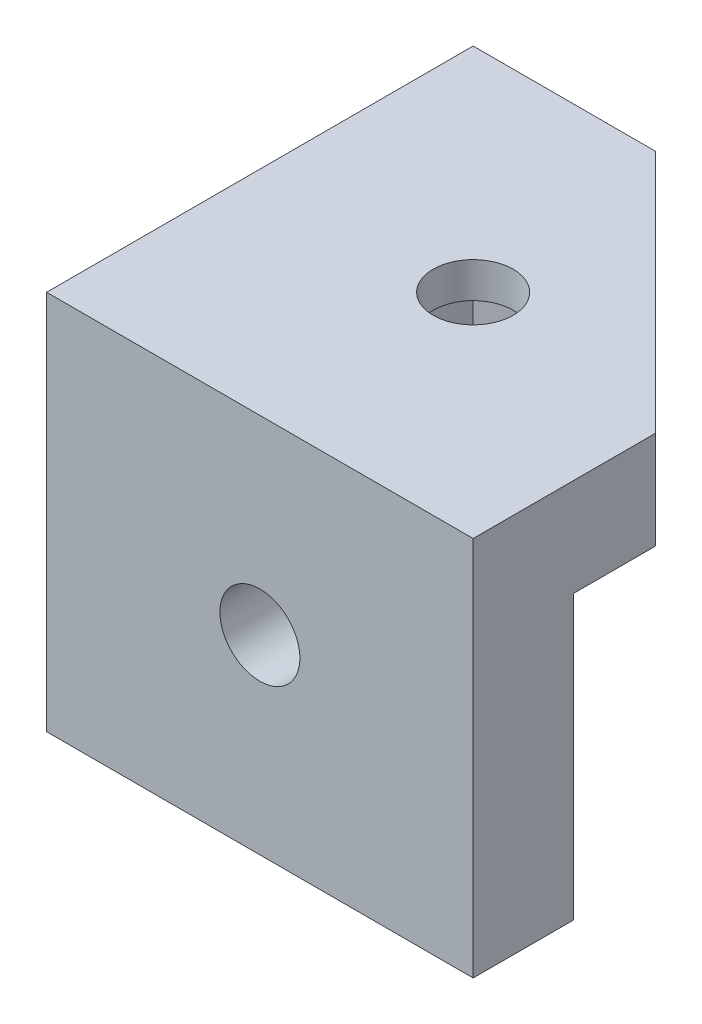
from build123d import *

# Parameters (mm, degrees)
SKETCH1_W                    = 38.1
SKETCH1_H                    = 38.1
MAIN_BODY_DEPTH              = 34
F_9_32_RIGHT_RAIL_DEPTH      = 64.712008287
F_9_32_RIGHT_RAIL_DEPTH_BACK = 5.55625
SKETCH3_R                    = 3.571875
SKETCH4_R                    = 3.571875
F_9_32_LEFT_RAIL_DEPTH       = 5.55625
F_9_32_TOPPER_DEPTH          = 64.712008287
F_9_32_TOPPER_DEPTH_BACK     = 10
SKETCH8_R                    = 3.571875
CUT_EXTRUDE3_START           = -5.55625
CUT_EXTRUDE3_DEPTH           = 32.54375
CUT_EXTRUDE4_START           = -5.55625
CUT_EXTRUDE4_DEPTH           = 32.54375
CUT_EXTRUDE12_START          = -30.825
CUT_EXTRUDE12_OUTLINE_W      = 29.119345377
CUT_EXTRUDE12_OUTLINE_H      = 29.119345377
CUT_EXTRUDE12_DEPTH          = 22.09375
CUT_EXTRUDE15_START          = -17
CUT_EXTRUDE15_DEPTH          = 13.825
CUT_EXTRUDE16_REACH          = 65.712
CUT_EXTRUDE17_REACH          = 65.712


# Read off the part's stored shape, not the designer's step: Cut-Extrude12
with BuildPart() as part:
    # Sketch1 → Main Body (new body)
    with BuildSketch(Plane(origin=(0, 0, 0), x_dir=(1, 0, 0), z_dir=(0, 1, 0))):
        with Locations((19.05, 19.05)):
            Rectangle(SKETCH1_W, SKETCH1_H)
    extrude(amount=MAIN_BODY_DEPTH)

    # Sketch3 → 9/32 Right Rail (cut, two sides: drawn at the far end of the back side and taken through both)
    with BuildSketch(Plane.XY.offset(-F_9_32_RIGHT_RAIL_DEPTH_BACK)):
        with Locations(Location((19.05, 17, 0), (0, 0, 180))):
            Circle(SKETCH3_R)
    extrude(amount=F_9_32_RIGHT_RAIL_DEPTH + F_9_32_RIGHT_RAIL_DEPTH_BACK, mode=Mode.SUBTRACT)

    # Sketch4 → 9/32 Left Rail (cut)
    with BuildSketch(Plane.ZY):
        with Locations((-19.05, 17)):
            Circle(SKETCH4_R)
    extrude(amount=-F_9_32_LEFT_RAIL_DEPTH, mode=Mode.SUBTRACT)

    # Sketch8 → 9/32 Topper (cut, two sides: drawn at the far end of the back side and taken through both)
    with BuildSketch(Plane(origin=(0, 34, 0), x_dir=(1, 0, 0), z_dir=(0, 1, 0)).offset(-F_9_32_TOPPER_DEPTH_BACK)):
        with Locations(Location((19.05, 19.05, 0), (0, 0, 90))):
            Circle(SKETCH8_R)
    extrude(amount=F_9_32_TOPPER_DEPTH + F_9_32_TOPPER_DEPTH_BACK, mode=Mode.SUBTRACT)

    # Sketch9 → Cut-Extrude3 (cut)
    with BuildSketch(Plane.ZY.offset(CUT_EXTRUDE3_START)):
        Polygon((-22.372470377, 22.7546875), (-25.694940754, 17), (-22.372470377, 11.2453125), (-15.727529623, 11.2453125), (-12.405059246, 17), (-15.727529623, 22.7546875), align=None)
    extrude(amount=-CUT_EXTRUDE3_DEPTH, mode=Mode.SUBTRACT)

    # Sketch10 → Cut-Extrude4 (cut)
    with BuildSketch(Plane.XY.offset(CUT_EXTRUDE4_START)):
        Polygon((15.727529623, 22.7546875), (12.405059246, 17), (15.727529623, 11.2453125), (22.372470377, 11.2453125), (25.694940754, 17), (22.372470377, 22.7546875), align=None)
    extrude(amount=-CUT_EXTRUDE4_DEPTH, mode=Mode.SUBTRACT)

    # Cut-Extrude12 outline → Cut-Extrude12 (cut)
    with BuildSketch(Plane(origin=(0, 34, 0), x_dir=(1, 0, 0), z_dir=(0, 1, 0)).offset(CUT_EXTRUDE12_START)):
        with Locations((23.540327312, 23.540327312)):
            Rectangle(CUT_EXTRUDE12_OUTLINE_W, CUT_EXTRUDE12_OUTLINE_H)
    extrude(amount=CUT_EXTRUDE12_DEPTH, mode=Mode.SUBTRACT)

    # Sketch14 → Cut-Extrude15 (cut)
    with BuildSketch(Plane(origin=(0, 34, 0), x_dir=(1, 0, 0), z_dir=(0, 1, 0)).offset(CUT_EXTRUDE15_START)):
        Polygon((23.748682668, 14.351317332), (25.468519889, 20.769837221), (20.769837221, 25.468519889), (14.351317332, 23.748682668), (12.631480111, 17.330162779), (17.330162779, 12.631480111), align=None)
    extrude(amount=CUT_EXTRUDE15_DEPTH, mode=Mode.SUBTRACT)

    # Sketch15 → Cut-Extrude16 (cut, up to next)
    with BuildSketch(Plane.XZ, mode=Mode.PRIVATE) as cut_extrude16_sk1:
        Polygon((38.1, -8.980654623), (8.980654623, -38.1), (38.1, -38.1), align=None)
    cut_extrude16_tool1 = extrude(cut_extrude16_sk1.sketch, amount=-CUT_EXTRUDE16_REACH, mode=Mode.PRIVATE) & part.part
    add(cut_extrude16_tool1.solids().sort_by_distance((28.393552, 0, -28.393552))[0], mode=Mode.SUBTRACT)

    # Sketch16 → Cut-Extrude17 (cut, up to next)
    with BuildSketch(Plane(origin=(0, 34, 0), x_dir=(1, 0, 0), z_dir=(0, 1, 0)), mode=Mode.PRIVATE) as cut_extrude17_sk1:
        Polygon((38.1, 38.1), (16.276714219, 38.1), (38.1, 16.276714219), align=None)
    cut_extrude17_tool1 = extrude(cut_extrude17_sk1.sketch, amount=-CUT_EXTRUDE17_REACH, mode=Mode.PRIVATE) & part.part
    add(cut_extrude17_tool1.solids().sort_by_distance((30.825571, 34, -30.825571))[0], mode=Mode.SUBTRACT)


solid = part.part
